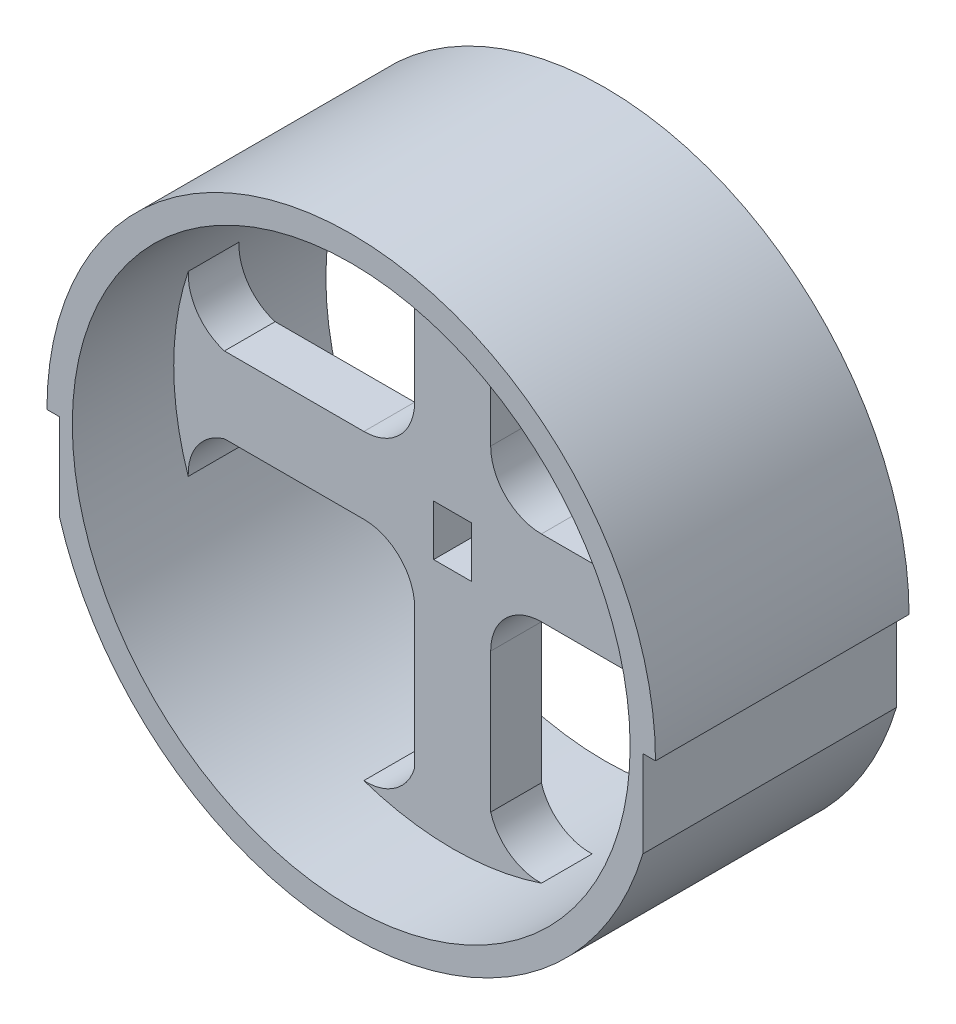
from build123d import *

# Parameters (mm, degrees)
SKETCH1_R               = 152.4
SKETCH1_R_2             = 139.7
BOSS_EXTRUDE1_DEPTH     = 63.5
BOSS_EXTRUDE2_DEPTH     = 12.7
CUT_EXTRUDE3_DEPTH      = 225.685936365
CUT_EXTRUDE3_DEPTH_BACK = 225.685936365
SKETCH4_W               = 19.05
SKETCH4_H               = 19.05
SKETCH7_W               = 19.05
SKETCH7_H               = 6.35
CUT_EXTRUDE4_DEPTH      = 229.6
SKETCH8_W               = 17.202693119
SKETCH8_H               = 50.8
CUT_EXTRUDE5_DEPTH      = 251.160988166


with BuildPart() as part:
    # Sketch1 → Boss-Extrude1 (new, symmetric)
    with BuildSketch(Plane.XY):
        Circle(SKETCH1_R)
        Circle(SKETCH1_R_2, mode=Mode.SUBTRACT)
    extrude(amount=BOSS_EXTRUDE1_DEPTH, both=True)

    # Sketch2 → Boss-Extrude2 (add, symmetric)
    with BuildSketch(Plane.XY):
        with BuildLine():
            Line((-44.45, 19.05), (-114.3, 19.05))
            ThreePointArc((-114.3, 19.05), (-127.736482233, 28.655491493), (-132.425396447, 44.492745205))
            Line((-132.425396447, 44.492745205), (-143.350279695, 19.05))
            Line((-143.350279695, 19.05), (-147.191797275, 19.05))
            Line((-147.191797275, 19.05), (-147.191797275, -19.05))
            Line((-147.191797275, -19.05), (-143.95681272, -19.05))
            Line((-143.95681272, -19.05), (-132.439750453, -44.45))
            ThreePointArc((-132.439750453, -44.45), (-127.731621931, -28.635000127), (-114.3, -19.05))
            Line((-114.3, -19.05), (-44.45, -19.05))
            ThreePointArc((-44.45, -19.05), (-26.489487758, -26.489487758), (-19.05, -44.45))
            Line((-19.05, -44.45), (-19.05, -114.3))
            ThreePointArc((-19.05, -114.3), (-28.655491493, -127.736482233), (-44.492745205, -132.425396447))
            Line((-44.492745205, -132.425396447), (-19.05, -143.350279695))
            Line((-19.05, -143.350279695), (-19.05, -143.95681272))
            Line((-19.05, -143.95681272), (19.05, -143.95681272))
            Line((19.05, -143.95681272), (44.45, -132.439750453))
            ThreePointArc((44.45, -132.439750453), (28.635000127, -127.731621931), (19.05, -114.3))
            Line((19.05, -114.3), (19.05, -44.45))
            ThreePointArc((19.05, -44.45), (26.489487758, -26.489487758), (44.45, -19.05))
            Line((44.45, -19.05), (114.3, -19.05))
            ThreePointArc((114.3, -19.05), (127.736482233, -28.655491493), (132.425396447, -44.492745205))
            Line((132.425396447, -44.492745205), (143.350279695, -19.05))
            Line((143.350279695, -19.05), (147.191797275, -19.05))
            Line((147.191797275, -19.05), (147.191797275, 19.05))
            Line((147.191797275, 19.05), (143.95681272, 19.05))
            Line((143.95681272, 19.05), (132.439750453, 44.45))
            ThreePointArc((132.439750453, 44.45), (127.731621931, 28.635000127), (114.3, 19.05))
            Line((114.3, 19.05), (44.45, 19.05))
            ThreePointArc((44.45, 19.05), (26.489487758, 26.489487758), (19.05, 44.45))
            Line((19.05, 44.45), (19.05, 114.3))
            ThreePointArc((19.05, 114.3), (28.655491493, 127.736482233), (44.492745205, 132.425396447))
            Line((44.492745205, 132.425396447), (19.05, 143.350279695))
            Line((19.05, 143.350279695), (19.05, 143.95681272))
            Line((19.05, 143.95681272), (-19.05, 143.95681272))
            Line((-19.05, 143.95681272), (-44.45, 132.439750453))
            ThreePointArc((-44.45, 132.439750453), (-28.635000127, 127.731621931), (-19.05, 114.3))
            Line((-19.05, 114.3), (-19.05, 44.45))
            ThreePointArc((-19.05, 44.45), (-26.489487758, 26.489487758), (-44.45, 19.05))
        make_face()
    extrude(amount=BOSS_EXTRUDE2_DEPTH, both=True)

    # Sketch4 → Cut-Extrude3 (cut, two sides: drawn at the far end of the back side and taken through both)
    with BuildSketch(Plane.XY.offset(-CUT_EXTRUDE3_DEPTH_BACK)):
        with Locations((0, -9.525)):
            Rectangle(SKETCH4_W, SKETCH4_H)
    extrude(amount=CUT_EXTRUDE3_DEPTH + CUT_EXTRUDE3_DEPTH_BACK, mode=Mode.SUBTRACT)

    # Sketch7 → Cut-Extrude4 (cut, through all)
    with BuildSketch(Plane.XY.offset(12.7)):
        with Locations((0, 3.175)):
            Rectangle(SKETCH7_W, SKETCH7_H)
    extrude(amount=-CUT_EXTRUDE4_DEPTH, mode=Mode.SUBTRACT)

    # Sketch8 → Cut-Extrude5 (cut, through all)
    with BuildSketch(Plane.XY.offset(63.5)):
        with Locations((-154.65134656, -25.4)):
            Rectangle(SKETCH8_W, SKETCH8_H)
    cut_extrude5 = extrude(amount=-CUT_EXTRUDE5_DEPTH, mode=Mode.SUBTRACT)

    # Mirror1: Cut-Extrude5 across plane
    add(cut_extrude5.mirror(Plane(origin=(0, 0, 0), x_dir=(0, 0, 1), z_dir=(1, 0, 0))), mode=Mode.SUBTRACT)


solid = part.part
